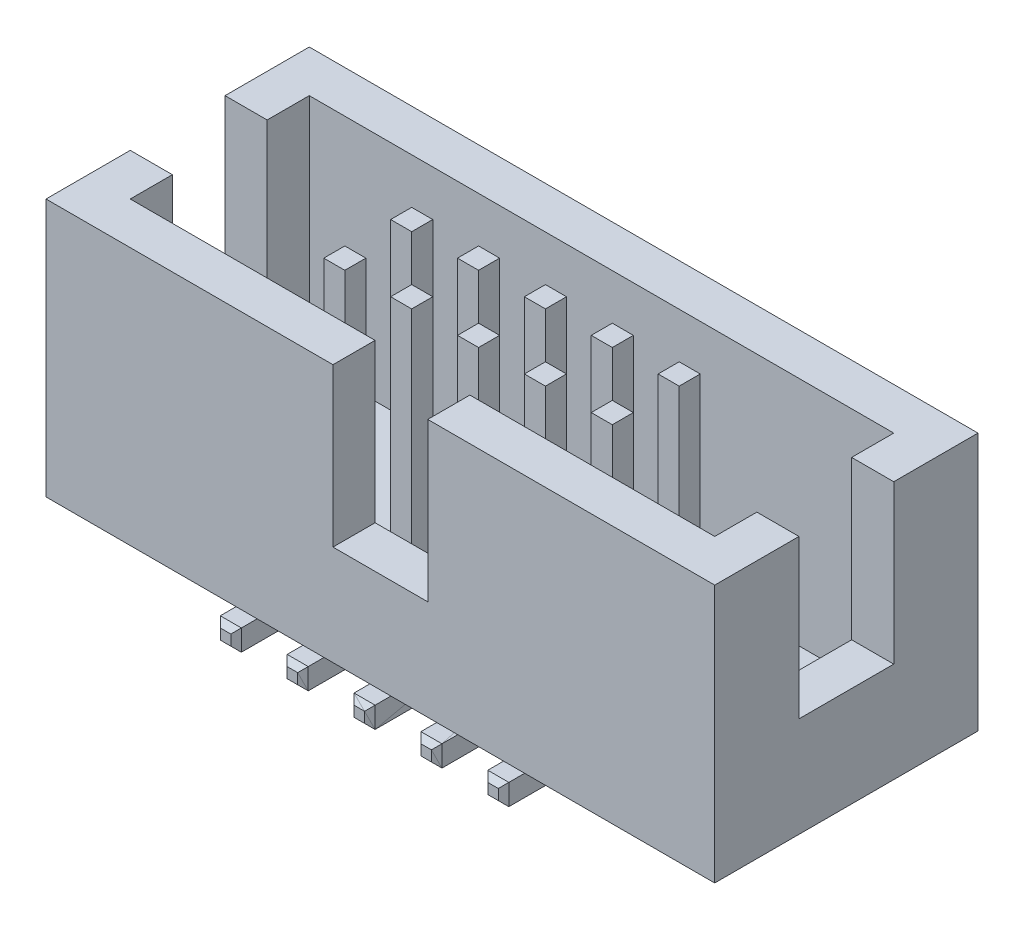
from build123d import *

# Parameters (mm, degrees)
SKETCH1_W                = 12.7
SKETCH1_H                = 5
BOSS_EXTRUDE1_DEPTH      = 4.9
SKETCH2_W                = 11.1
SKETCH2_H                = 3.4
CUT_EXTRUDE1_DEPTH       = 4.4
CUT_EXTRUDE2_DEPTH       = 3
SKETCH4_W                = 0.4
SKETCH4_H                = 0.4
BOSS_EXTRUDE2_DEPTH      = 4.4
LPATTERN1_COUNT          = 3
LPATTERN1_PITCH          = 1.27
LPATTERN1_2_COUNT        = 3
LPATTERN1_2_PITCH        = 1.27
BOSS_EXTRUDE3_DEPTH      = 0.4
BOSS_EXTRUDE3_DEPTH_BACK = 1.5
SKETCH5_W                = 0.4
SKETCH5_H                = 0.4
CHAMFER4_SIZE            = 0.1
LPATTERN2_COUNT          = 3
LPATTERN2_PITCH          = 1.27
LPATTERN2_2_COUNT        = 3
LPATTERN2_2_PITCH        = 1.27


with BuildPart() as part:
    # Sketch1 → Boss-Extrude1 (new body)
    with BuildSketch(Plane(origin=(0, 0.4, 0), x_dir=(1, 0, 0), z_dir=(0, 1, 0))):
        Rectangle(SKETCH1_W, SKETCH1_H)
    extrude(amount=BOSS_EXTRUDE1_DEPTH)

    # Sketch2 → Cut-Extrude1 (cut)
    with BuildSketch(Plane(origin=(0, 5.3, 0), x_dir=(1, 0, 0), z_dir=(0, 1, 0))):
        Rectangle(SKETCH2_W, SKETCH2_H)
    extrude(amount=-CUT_EXTRUDE1_DEPTH, mode=Mode.SUBTRACT)

    # Sketch3 → Cut-Extrude2 (cut)
    with BuildSketch(Plane(origin=(0, 5.3, 0), x_dir=(1, 0, 0), z_dir=(0, 1, 0))):
        Polygon((-6.35, -0.9), (-0.9, -0.9), (-0.9, -4.1), (0.9, -4.1), (0.9, -0.9), (6.35, -0.9), (6.35, 0.9), (-6.35, 0.9), align=None)
    extrude(amount=-CUT_EXTRUDE2_DEPTH, mode=Mode.SUBTRACT)


with BuildPart() as body_2:
    # Sketch4 → Boss-Extrude2 (new body)
    with BuildSketch(Plane(origin=(0, 0.9, 0), x_dir=(1, 0, 0), z_dir=(0, 1, 0))):
        with Locations((0, -0.635)):
            Rectangle(SKETCH4_W, SKETCH4_H)
    extrude(amount=BOSS_EXTRUDE2_DEPTH)


with BuildPart() as lpattern1_1:
    # LPattern1: pattern copy
    add(body_2.part.moved(Location(Vector(-1, 0, 0) * (1 * LPATTERN1_PITCH))))


with BuildPart() as lpattern1_2:
    # LPattern1: pattern copy
    add(body_2.part.moved(Location(Vector(-1, 0, 0) * (2 * LPATTERN1_PITCH))))


with BuildPart() as lpattern1_2_1:
    # LPattern1 2: pattern copy
    add(body_2.part.moved(Location(Vector(1, 0, 0) * (1 * LPATTERN1_2_PITCH))))


with BuildPart() as lpattern1_2_2:
    # LPattern1 2: pattern copy
    add(body_2.part.moved(Location(Vector(1, 0, 0) * (2 * LPATTERN1_2_PITCH))))


with BuildPart() as body_7:
    # Mirror4: mirrored copy
    add(body_2.part.mirror(Plane.XY))


with BuildPart() as body_8:
    # Mirror4 2: mirrored copy
    add(lpattern1_1.part.mirror(Plane.XY))


with BuildPart() as body_9:
    # Mirror4 3: mirrored copy
    add(lpattern1_2.part.mirror(Plane.XY))


with BuildPart() as body_10:
    # Mirror4 4: mirrored copy
    add(lpattern1_2_1.part.mirror(Plane.XY))


with BuildPart() as body_11:
    # Mirror4 5: mirrored copy
    add(lpattern1_2_2.part.mirror(Plane.XY))


with BuildPart() as body_12:
    # Sketch5 → Boss-Extrude3 (new, two sides: drawn at the far end of the back side and taken through both)
    with BuildSketch(Plane.XY.offset(2.5).offset(-BOSS_EXTRUDE3_DEPTH_BACK)):
        with Locations((0, 0.2)):
            Rectangle(SKETCH5_W, SKETCH5_H)
    extrude(amount=BOSS_EXTRUDE3_DEPTH + BOSS_EXTRUDE3_DEPTH_BACK)

    # Chamfer4
    chamfer4_edges = [body_12.edges().sort_by_distance(p)[0] for p in [
        (-0.2, 0.2, 2.9),
        (0, 0, 2.9),
        (0.2, 0.2, 2.9),
        (0, 0.4, 2.9),
    ]]
    chamfer(chamfer4_edges, length=CHAMFER4_SIZE)


with BuildPart() as lpattern2_1:
    # LPattern2: pattern copy
    add(body_12.part.moved(Location(Vector(1, 0, 0) * (1 * LPATTERN2_PITCH))))


with BuildPart() as lpattern2_2:
    # LPattern2: pattern copy
    add(body_12.part.moved(Location(Vector(1, 0, 0) * (2 * LPATTERN2_PITCH))))


with BuildPart() as lpattern2_2_1:
    # LPattern2 2: pattern copy
    add(body_12.part.moved(Location(Vector(-1, 0, 0) * (1 * LPATTERN2_2_PITCH))))


with BuildPart() as lpattern2_2_2:
    # LPattern2 2: pattern copy
    add(body_12.part.moved(Location(Vector(-1, 0, 0) * (2 * LPATTERN2_2_PITCH))))


with BuildPart() as lpattern2_2_3:
    # LPattern2 2: pattern copy
    add(lpattern2_1.part.moved(Location(Vector(-1, 0, 0) * (1 * LPATTERN2_2_PITCH))))


with BuildPart() as lpattern2_2_4:
    # LPattern2 2: pattern copy
    add(lpattern2_1.part.moved(Location(Vector(-1, 0, 0) * (2 * LPATTERN2_2_PITCH))))


with BuildPart() as lpattern2_2_5:
    # LPattern2 2: pattern copy
    add(lpattern2_2.part.moved(Location(Vector(-1, 0, 0) * (1 * LPATTERN2_2_PITCH))))


with BuildPart() as lpattern2_2_6:
    # LPattern2 2: pattern copy
    add(lpattern2_2.part.moved(Location(Vector(-1, 0, 0) * (2 * LPATTERN2_2_PITCH))))


with BuildPart() as body_21:
    # Mirror5: read off the stored shape, not the designer's step
    # Mirror5: mirrored copy
    add(lpattern2_2.part.mirror(Plane.XY))


with BuildPart() as body_22:
    # Mirror5 2: mirrored copy
    add(lpattern2_1.part.mirror(Plane.XY))


with BuildPart() as body_23:
    # Mirror5 3: mirrored copy
    add(body_12.part.mirror(Plane.XY))


with BuildPart() as body_24:
    # Mirror5 4: mirrored copy
    add(lpattern2_2_1.part.mirror(Plane.XY))


with BuildPart() as body_25:
    # Mirror5 5: mirrored copy
    add(lpattern2_2_2.part.mirror(Plane.XY))


solid = Compound([part.part, body_2.part, lpattern1_1.part, lpattern1_2.part, lpattern1_2_1.part, lpattern1_2_2.part, body_7.part, body_8.part, body_9.part, body_10.part, body_11.part, body_12.part, lpattern2_1.part, lpattern2_2.part, lpattern2_2_1.part, lpattern2_2_2.part, lpattern2_2_3.part, lpattern2_2_4.part, lpattern2_2_5.part, lpattern2_2_6.part, body_21.part, body_22.part, body_23.part, body_24.part, body_25.part])
